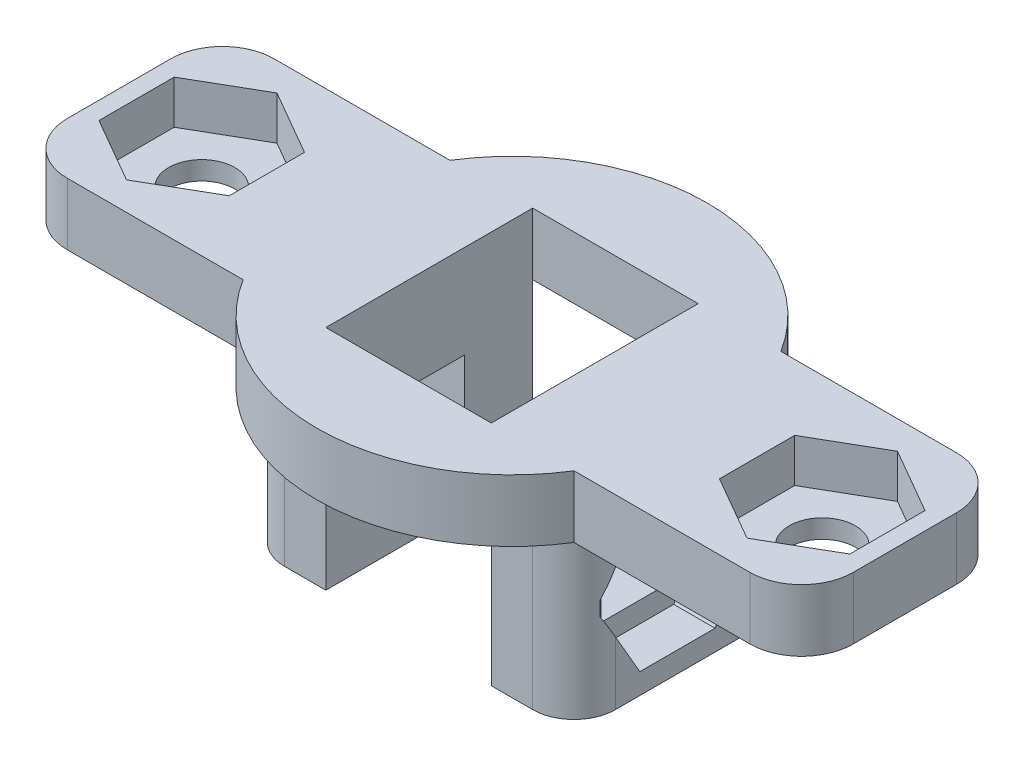
from build123d import *

# Parameters (mm, degrees)
SKETCH1_W           = 11
SKETCH1_H           = 8
SKETCH1_W_2         = 4
SKETCH1_H_2         = 10
SKETCH1_H_3         = 1
BOSS_EXTRUDE1_DEPTH = 3
SKETCH1_3_W         = 4
SKETCH1_3_H         = 10
BOSS_EXTRUDE2_DEPTH = 8
CUT_EXTRUDE5_DEPTH  = 2.1
HOLE1_D             = 3.2
SKETCH5_W           = 3.4
SKETCH5_H           = 4.5
CUT_EXTRUDE1_DEPTH  = 4
CUT_EXTRUDE4_DEPTH  = 1
SKETCH6_W           = 3.4
SKETCH6_H           = 4.5
CUT_EXTRUDE2_DEPTH  = 2
SKETCH6_3_W         = 3.4
SKETCH6_3_H         = 4.5
CUT_EXTRUDE3_DEPTH  = 32.643953788
FILLET1_R           = 2.5
FILLET2_R           = 2


with BuildPart() as part:
    # Sketch1 → Boss-Extrude1 (new body)
    with BuildSketch(Plane(origin=(0, 0, 0), x_dir=(1, 0, 0), z_dir=(0, 1, 0))):
        with Locations((-32.5, 5)):
            Rectangle(SKETCH1_W, SKETCH1_H)
        Polygon((-23, 10), (-27, 10), (-27, 9), (-27, 1), (-27, 0), (-23, 0), align=None)
        with BuildLine():
            ThreePointArc((-11, 10), (-19, 14.433981132), (-27, 10))
            Line((-27, 10), (-23, 10))
            Line((-23, 10), (-15, 10))
            Line((-15, 10), (-11, 10))
        make_face()
        with Locations((-13, 5)):
            Rectangle(SKETCH1_W_2, SKETCH1_H_2)
        with BuildLine():
            Line((-15, 0), (-23, 0))
            Line((-23, 0), (-27, 0))
            ThreePointArc((-27, 0), (-19, -4.433981132), (-11, 0))
            Line((-11, 0), (-15, 0))
        make_face()
        with Locations((-5.5, 5)):
            Rectangle(SKETCH1_W, SKETCH1_H_2)
        with Locations((-32.5, 9.5)):
            Rectangle(SKETCH1_W, SKETCH1_H_3)
        with Locations((-32.5, 0.5)):
            Rectangle(SKETCH1_W, SKETCH1_H_3)
    extrude(amount=BOSS_EXTRUDE1_DEPTH)

    # Sketch1<3> → Boss-Extrude2 (add)
    with BuildSketch(Plane(origin=(0, 0, 0), x_dir=(1, 0, 0), z_dir=(0, 1, 0))):
        with Locations((-25, 5)):
            Rectangle(SKETCH1_3_W, SKETCH1_3_H)
        with Locations((-13, 5)):
            Rectangle(SKETCH1_3_W, SKETCH1_3_H)
    extrude(amount=-BOSS_EXTRUDE2_DEPTH)

    # Sketch3 → Cut-Extrude5 (cut)
    with BuildSketch(Plane(origin=(0, 3, 0), x_dir=(1, 0, 0), z_dir=(0, 1, 0))):
        Polygon((-7.15, 6.818653348), (-7.15, 3.181346652), (-4, 1.362693304), (-0.85, 3.181346652), (-0.85, 6.818653348), (-4, 8.637306696), align=None)
        Polygon((-30.85, 3.181346652), (-30.85, 6.818653348), (-34, 8.637306696), (-37.15, 6.818653348), (-37.15, 3.181346652), (-34, 1.362693304), align=None)
    extrude(amount=-CUT_EXTRUDE5_DEPTH, mode=Mode.SUBTRACT)

    # Hole1 (through all)
    with Locations(Plane(origin=(-4, 3, -5), x_dir=(0, 0, 1), z_dir=(0, 1, 0))):
        with Locations((0, 0), (0, -30)):
            Hole(HOLE1_D / 2)

    # Sketch5 → Cut-Extrude1 (cut)
    with BuildSketch(Plane.ZY.offset(27)):
        with Locations((-5, -3.75)):
            Rectangle(SKETCH5_W, SKETCH5_H)
    extrude(amount=-CUT_EXTRUDE1_DEPTH, mode=Mode.SUBTRACT)

    # Sketch5<4> → Cut-Extrude4 (cut)
    with BuildSketch(Plane.ZY.offset(27)):
        Polygon((-5, -1.5), (-5, -0.5), (-7.7, -0.5), (-7.7, -7), (-5, -7), (-5, -6), (-6.7, -6), (-6.7, -1.5), align=None)
        Polygon((-2.3, -0.5), (-5, -0.5), (-5, -1.5), (-3.3, -1.5), (-3.3, -6), (-5, -6), (-5, -7), (-2.3, -7), align=None)
    extrude(amount=-CUT_EXTRUDE4_DEPTH, mode=Mode.SUBTRACT)

    # Sketch6 → Cut-Extrude2 (cut)
    # profile 1 of 5: a face of its own
    with BuildSketch(Plane(origin=(-11, 0, 0), x_dir=(0, 0, -1), z_dir=(1, 0, 0))):
        Polygon((3.181346652, -6.3), (6.818653348, -6.3), (8.435234102, -3.5), (6.818653348, -0.7), (3.181346652, -0.7), (1.564765898, -3.5), align=None)
        with Locations((5, -3.75)):
            Rectangle(SKETCH6_W, SKETCH6_H, mode=Mode.SUBTRACT)
    # profile 2 of 5: a face of its own
    with BuildSketch(Plane(origin=(-11, 0, 0), x_dir=(0, 0, -1), z_dir=(1, 0, 0))):
        Polygon((8.435234102, -3.5), (6.818653348, -6.3), (3.181346652, -6.3), (1.564765898, -3.5), (1.362693304, -3.85), (3.181346652, -7), (6.818653348, -7), (8.637306696, -3.85), align=None)
    # profile 3 of 5: a face of its own
    with BuildSketch(Plane(origin=(-11, 0, 0), x_dir=(0, 0, -1), z_dir=(1, 0, 0))):
        Polygon((6.818653348, -0.7), (8.435234102, -3.5), (8.637306696, -3.15), (6.818653348, 0), (3.181346652, 0), (1.362693304, -3.15), (1.564765898, -3.5), (3.181346652, -0.7), align=None)
    # profile 4 of 5: a face of its own
    with BuildSketch(Plane(origin=(-11, 0, 0), x_dir=(0, 0, -1), z_dir=(1, 0, 0))):
        Polygon((8.637306696, -3.15), (8.435234102, -3.5), (8.637306696, -3.85), align=None)
    # profile 5 of 5: a face of its own
    with BuildSketch(Plane(origin=(-11, 0, 0), x_dir=(0, 0, -1), z_dir=(1, 0, 0))):
        Polygon((1.362693304, -3.85), (1.564765898, -3.5), (1.362693304, -3.15), align=None)
    extrude(amount=-CUT_EXTRUDE2_DEPTH, mode=Mode.SUBTRACT)

    # Sketch6<3> → Cut-Extrude3 (cut, through all)
    with BuildSketch(Plane(origin=(-11, 0, 0), x_dir=(0, 0, -1), z_dir=(1, 0, 0))):
        with Locations((5, -3.75)):
            Rectangle(SKETCH6_3_W, SKETCH6_3_H)
    extrude(amount=-CUT_EXTRUDE3_DEPTH, mode=Mode.SUBTRACT)

    # Fillet1
    fillet1_edges = [part.edges().sort_by_distance(p)[0] for p in [
        (-38, 1.5, 0),
        (-38, 1.5, -10),
        (0, 1.5, -10),
        (0, 1.5, 0),
    ]]
    fillet(fillet1_edges, radius=FILLET1_R)

    # Fillet2
    # the kernel refuses this fillet: 2 mm, written as the material it takes off along each edge
    with BuildSketch(Plane(origin=(-11, 0, 0), x_dir=(-1, 0, 0), z_dir=(0, -1, 0)), Plane(origin=(-27, 0, -10), x_dir=(1, 0, 0), z_dir=(0, -1, 0))) as fillet2_piece_1:
        with BuildLine():
            CenterArc((FILLET2_R, FILLET2_R), FILLET2_R, 180, 90)
            Line((0, FILLET2_R), (0, 0))
            Line((0, 0), (FILLET2_R, 0))
        make_face()
    extrude(amount=13, mode=Mode.SUBTRACT)
    with BuildSketch(Plane(origin=(-11, 0, -10), x_dir=(-1, 0, 0), z_dir=(0, -1, 0)), Plane(origin=(-27, 0, 0), x_dir=(1, 0, 0), z_dir=(0, -1, 0))) as fillet2_piece_2:
        with BuildLine():
            CenterArc((FILLET2_R, -FILLET2_R), FILLET2_R, 90, 90)
            Line((0, -FILLET2_R), (0, 0))
            Line((0, 0), (FILLET2_R, 0))
        make_face()
    extrude(amount=13, mode=Mode.SUBTRACT)


solid = part.part
